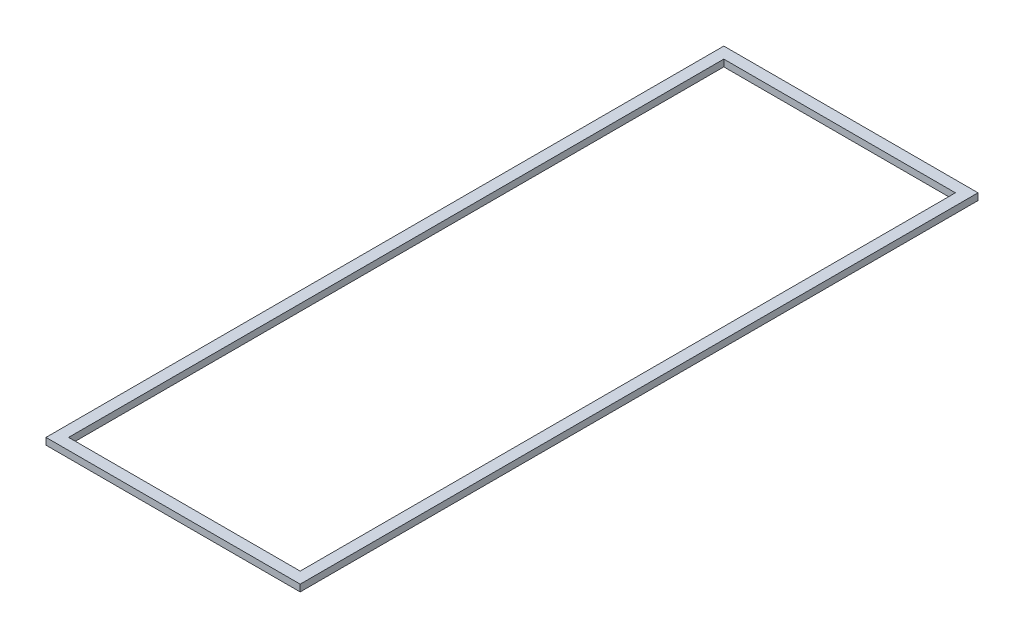
from build123d import *

# Parameters (mm, degrees)
SKETCH_1_W      = 450
SKETCH_1_H      = 1200
SKETCH_1_W_2    = 410
SKETCH_1_H_2    = 1160
EXTRUDE_1_DEPTH = 12


with BuildPart() as part:
    # Эскиз1 → Вытянуть-Тонкостенный1 (new body)
    with BuildSketch(Plane(origin=(0, 0, 0), x_dir=(1, 0, 0), z_dir=(0, 1, 0))):
        with Locations((225, 600)):
            Rectangle(SKETCH_1_W, SKETCH_1_H)
        with Locations((225, 600)):
            Rectangle(SKETCH_1_W_2, SKETCH_1_H_2, mode=Mode.SUBTRACT)
    extrude(amount=EXTRUDE_1_DEPTH)


solid = part.part
